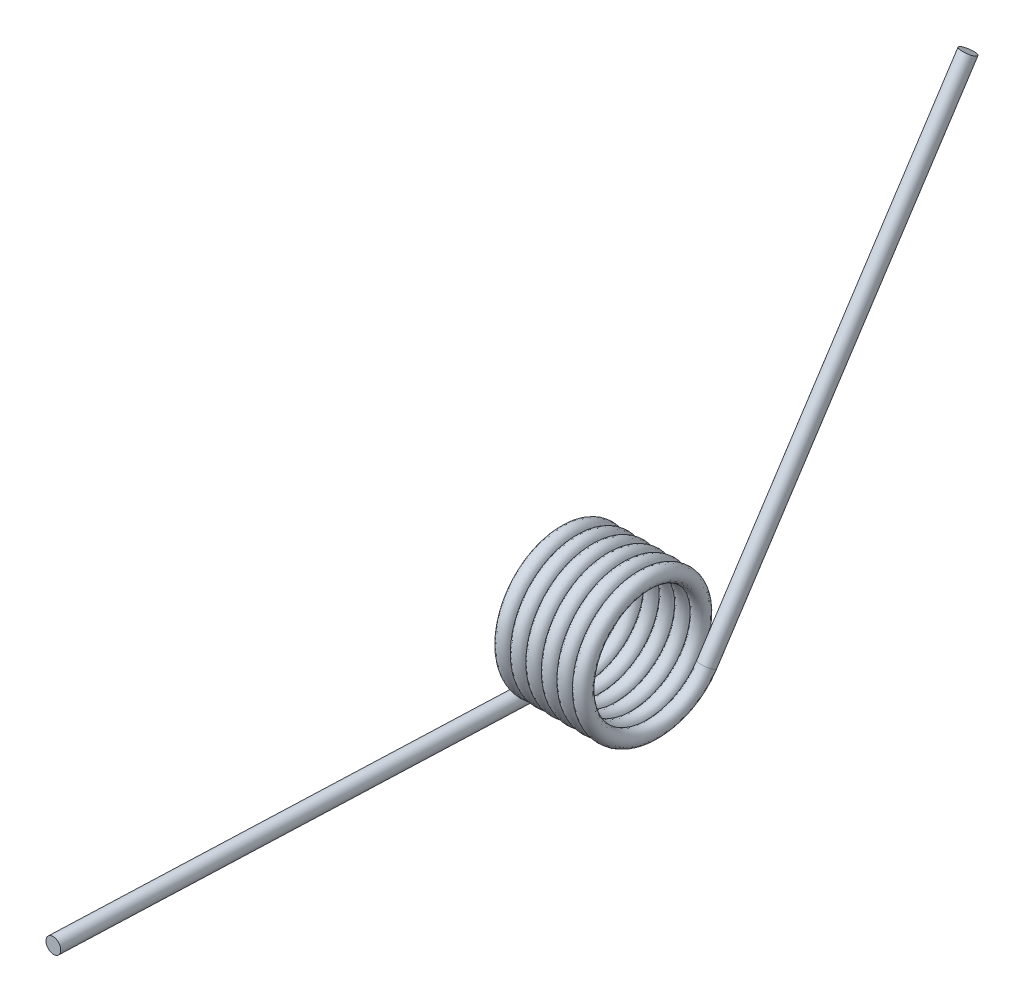
from build123d import *

# Parameters (mm, degrees)
SWEEP1_PITCH   = 2.4384
SKETCH4_R      = 1.2065
EXTRUDE1_DEPTH = 76.2
SKETCH5_R      = 1.2065
EXTRUDE2_DEPTH = 76.2


with BuildPart() as part:
    # Sweep1: the profile of Sketch3 screwed along a right-hand helix of 6.166667 turns, 6 arcs to a turn; built about Z, then put on its axis
    sweep1_z = Axis((0, 0, 0), (0, 0, 1))
    sweep1_corners = [(9.88323439, -0.047460601, 1.205240148), (11.061374251, 0.001103098, -0.028012679), (9.82716561, 0.047460601, -1.205240148), (8.649025749, -0.001103098, 0.028012679)]
    with BuildLine(mode=Mode.PRIVATE) as sweep1_profile:
        ThreePointArc((9.88323439, -0.047460601, 1.205240148), (10.727917299, -0.032779704, 0.832425526), (11.061374251, 0.001103098, -0.028012679))
        ThreePointArc((11.061374251, 0.001103098, -0.028012679), (10.688270685, 0.034339721, -0.872041437), (9.82716561, 0.047460601, -1.205240148))
        ThreePointArc((9.82716561, 0.047460601, -1.205240148), (8.982482701, 0.032779704, -0.832425526), (8.649025749, -0.001103098, 0.028012679))
        ThreePointArc((8.649025749, -0.001103098, 0.028012679), (9.022129315, -0.034339721, 0.872041437), (9.88323439, -0.047460601, 1.205240148))
    sweep1_cap = Face(sweep1_profile.wire())
    sweep1_arcs = [((9.88323439, -0.047460601, 1.205240148), (11.08940864, -0.046357502, 1.177227469), (11.061374251, 0.001103098, -0.028012679), (1, 0.7071067811865476, 1)), ((11.061374251, 0.001103098, -0.028012679), (11.033339861, 0.048563699, -1.233252827), (9.82716561, 0.047460601, -1.205240148), (1, 0.7071067811865476, 1)), ((9.82716561, 0.047460601, -1.205240148), (8.62099136, 0.046357502, -1.177227469), (8.649025749, -0.001103098, 0.028012679), (1, 0.7071067811865476, 1)), ((8.649025749, -0.001103098, 0.028012679), (8.677060139, -0.048563699, 1.233252827), (9.88323439, -0.047460601, 1.205240148), (1, 0.7071067811865476, 1))]  # start, shoulder, end, weights
    sweep1_turn_angles = [0, 30, 60, 90, 120, 150, 180, 210, 240, 270, 300, 330, 360]
    sweep1_turn_weights = [1, 0.8660254037844387, 1, 0.8660254037844387, 1, 0.8660254037844387, 1, 0.8660254037844387, 1, 0.8660254037844387, 1, 0.8660254037844387, 1]
    sweep1_turn_sides = [Face.make_bezier_surface([[Vector(p[j][0], p[j][1], 0).rotate(sweep1_z, sweep1_turn_angles[2 * i + k]) / sweep1_turn_weights[2 * i + k] + Vector(0, 0, p[j][2] + SWEEP1_PITCH * sweep1_turn_angles[2 * i + k] / 360) for k in range(3)] for j in range(3)], [[p[3][j] * sweep1_turn_weights[2 * i + k] for k in range(3)] for j in range(3)]) for p in sweep1_arcs for i in range(6)]
    sweep1_last_angles = [2160, 2190, 2220]
    sweep1_last_weights = [1, 0.866025403784403, 1]
    sweep1_last_sides = [Face.make_bezier_surface([[Vector(p[j][0], p[j][1], 0).rotate(sweep1_z, sweep1_last_angles[2 * i + k]) / sweep1_last_weights[2 * i + k] + Vector(0, 0, p[j][2] + SWEEP1_PITCH * sweep1_last_angles[2 * i + k] / 360) for k in range(3)] for j in range(3)], [[p[3][j] * sweep1_last_weights[2 * i + k] for k in range(3)] for j in range(3)]) for p in sweep1_arcs for i in range(1)]
    sweep1 = Plane(origin=(0, 0, 0), x_dir=(0, -1, 0), z_dir=(1, 0, 0)) * Solid(Shell([*[p.moved(Location((0, 0, SWEEP1_PITCH * i))) for i in range(6) for p in sweep1_turn_sides], *sweep1_last_sides, sweep1_cap, sweep1_cap.rotate(sweep1_z, 2220).moved(Location((0, 0, SWEEP1_PITCH * 2220 / 360)))]))
    add(sweep1)

    # Sketch4 → Extrude1 (add)
    with BuildSketch(Plane(origin=(0, 0, 0), x_dir=(-0.9989557795402644, 0.02323612909274865, -0.03933742274079572), z_dir=(-0.03934804652827867, -1.074661193367632e-14, 0.9992255657429951))):
        with Locations(Location((-0.228996699, 9.852539142, 0), (0, 0, 181.33145196))):
            Circle(SKETCH4_R)
    extrude(amount=EXTRUDE1_DEPTH)

    # Sketch5 → Extrude2 (add)
    with BuildSketch(Plane(origin=(0.023281008, 0.51200331, -0.295605249), x_dir=(0.9981783086806318, -0.05692649144876503, -0.019985961343079544), z_dir=(0.03934804652827868, 0.8653547240443688, -0.49961278287139826))):
        with Locations(Location((15.460495825, 9.15714575, 0), (0, 0, 177.376564152))):
            Circle(SKETCH5_R)
    extrude(amount=EXTRUDE2_DEPTH)


solid = part.part
